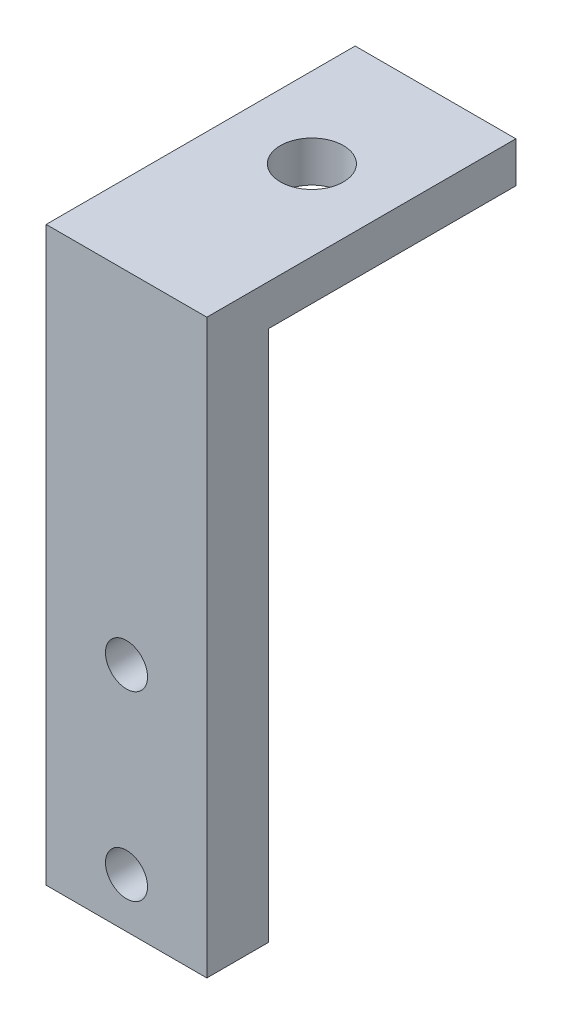
from build123d import *

# Parameters (mm, degrees)
BOSS_EXTRUDE1_DEPTH = 13
SKETCH2_R           = 1.7
CUT_EXTRUDE1_DEPTH  = 53.083490666
SKETCH3_R           = 2.55
CUT_EXTRUDE2_DEPTH  = 55.200461253


with BuildPart() as part:
    # Sketch1 → Boss-Extrude1 (new body)
    with BuildSketch(Plane(origin=(0, 0, 0), x_dir=(0, 0, -1), z_dir=(1, 0, 0))):
        Polygon((0, 0), (0, 46.3), (25, 46.3), (25, 43), (5, 43), (5, 0), align=None)
    extrude(amount=BOSS_EXTRUDE1_DEPTH)

    # Sketch2 → Cut-Extrude1 (cut, through all)
    with BuildSketch(Plane(origin=(0, 0, -5), x_dir=(-1, 0, 0), z_dir=(0, 0, -1))):
        with Locations((-6.5, 18.7)):
            Circle(SKETCH2_R)
        with Locations((-6.5, 4)):
            Circle(SKETCH2_R)
    extrude(amount=-CUT_EXTRUDE1_DEPTH, mode=Mode.SUBTRACT)

    # Sketch3 → Cut-Extrude2 (cut, through all)
    with BuildSketch(Plane(origin=(0, 46.3, 0), x_dir=(1, 0, 0), z_dir=(0, 1, 0))):
        with Locations((6.5, 15)):
            Circle(SKETCH3_R)
    extrude(amount=-CUT_EXTRUDE2_DEPTH, mode=Mode.SUBTRACT)


solid = part.part
